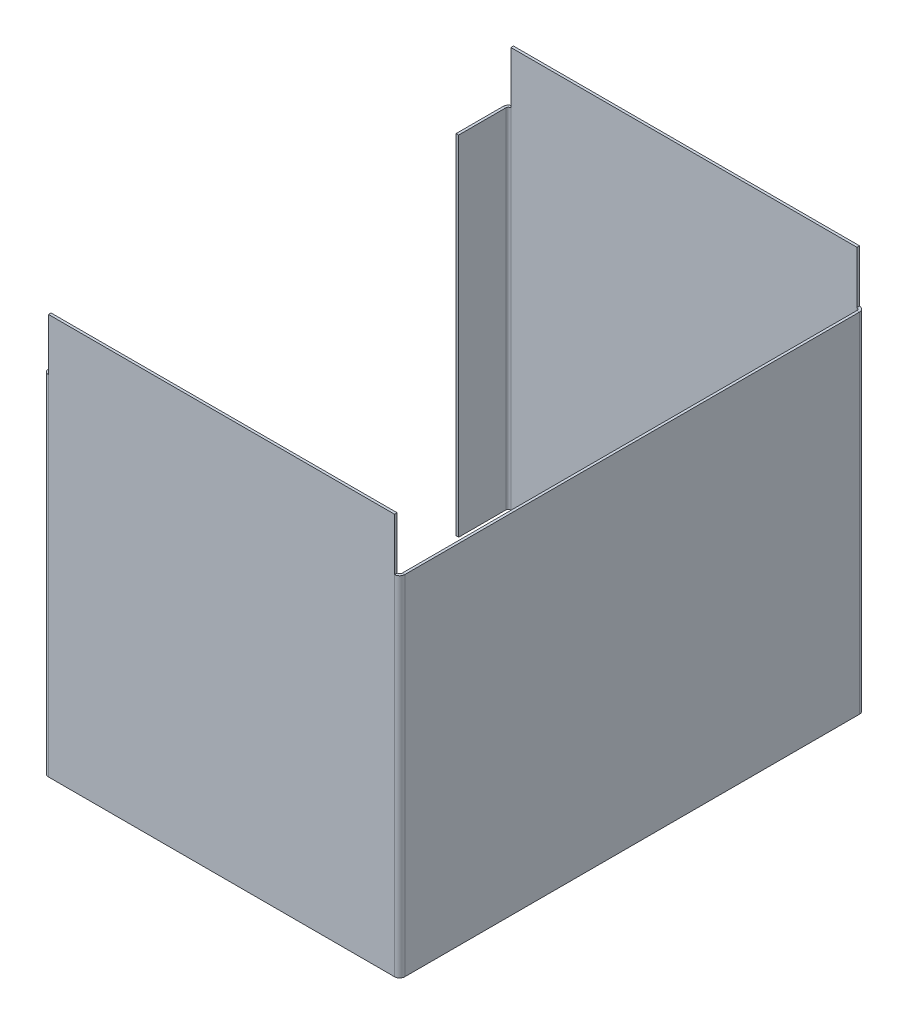
from build123d import *

# Parameters (mm, degrees)
BASE_FLANGE1_DEPTH      = 100
EDGE_FLANGE1_DEPTH      = 100
EDGE_FLANGE1_BEND_DEPTH = 100
SKETCH8_W               = 99.3268
SKETCH8_H               = 0.7366
BOSS_EXTRUDE1_DEPTH     = 15


# Sheet-metal steps are written as plain solids
with BuildPart() as part:
    # Sketch1 → Base-Flange1 (new body)
    with BuildSketch(Plane(origin=(0, 0, 0), x_dir=(1, 0, 0), z_dir=(0, 1, 0))):
        with BuildLine():
            Line((-100, 132), (-0.7366, 132))
            ThreePointArc((-0.7366, 132), (-0.215745145, 131.784254855), (0, 131.2634))
            Line((0, 131.2634), (0, 0.7366))
            ThreePointArc((0, 0.7366), (-0.215745145, 0.215745145), (-0.7366, 0))
            Line((-0.7366, 0), (-100, 0))
            Line((-100, 0), (-100, -0.7366))
            Line((-100, -0.7366), (-0.7366, -0.7366))
            ThreePointArc((-0.7366, -0.7366), (0.30510971, -0.30510971), (0.7366, 0.7366))
            Line((0.7366, 0.7366), (0.7366, 131.2634))
            ThreePointArc((0.7366, 131.2634), (0.30510971, 132.30510971), (-0.7366, 132.7366))
            Line((-0.7366, 132.7366), (-100, 132.7366))
            Line((-100, 132.7366), (-100, 132))
        make_face()
    extrude(amount=BASE_FLANGE1_DEPTH)

    # Edge-Flange1 section (across the edge) → Edge-Flange1 (add)
    with BuildSketch(Plane(origin=(-100.8, 100, -132), x_dir=(1, 0, 0), z_dir=(0, -1, 0))):
        with BuildLine():
            Line((-0.7366, 0.7366), (-0.7366, 14.2634))
            Line((-0.7366, 14.2634), (0, 14.2634))
            Line((0, 14.2634), (0, 0.7366))
            ThreePointArc((0, 0.7366), (0.215745145, 0.215745145), (0.7366, 0))
            Line((0.7366, 0), (0.8, 0))
            Line((0.8, 0), (0.8, -0.7366))
            Line((0.8, -0.7366), (0.7366, -0.7366))
            ThreePointArc((0.7366, -0.7366), (-0.30510971, -0.30510971), (-0.7366, 0.7366))
        make_face()
    extrude(amount=EDGE_FLANGE1_DEPTH)

    # Edge-Flange1 section 2 (across the edge) → Edge-Flange1 bend (add)
    with BuildSketch(Plane(origin=(-100.8, 0, 0), x_dir=(1, 0, 0), z_dir=(0, 1, 0))):
        with BuildLine():
            Line((-0.7366, 0.7366), (-0.7366, 14.2634))
            Line((-0.7366, 14.2634), (0, 14.2634))
            Line((0, 14.2634), (0, 0.7366))
            ThreePointArc((0, 0.7366), (0.215745145, 0.215745145), (0.7366, 0))
            Line((0.7366, 0), (0.8, 0))
            Line((0.8, 0), (0.8, -0.7366))
            Line((0.8, -0.7366), (0.7366, -0.7366))
            ThreePointArc((0.7366, -0.7366), (-0.30510971, -0.30510971), (-0.7366, 0.7366))
        make_face()
    extrude(amount=EDGE_FLANGE1_BEND_DEPTH)

    # Sketch8 → Boss-Extrude1 (add)
    with BuildSketch(Plane(origin=(0, 100, 0), x_dir=(1, 0, 0), z_dir=(0, 1, 0))):
        with Locations((-50.4, -0.3683)):
            Rectangle(SKETCH8_W, SKETCH8_H)
        with Locations((-50.4, 132.3683)):
            Rectangle(SKETCH8_W, SKETCH8_H)
    extrude(amount=BOSS_EXTRUDE1_DEPTH)


solid = part.part
